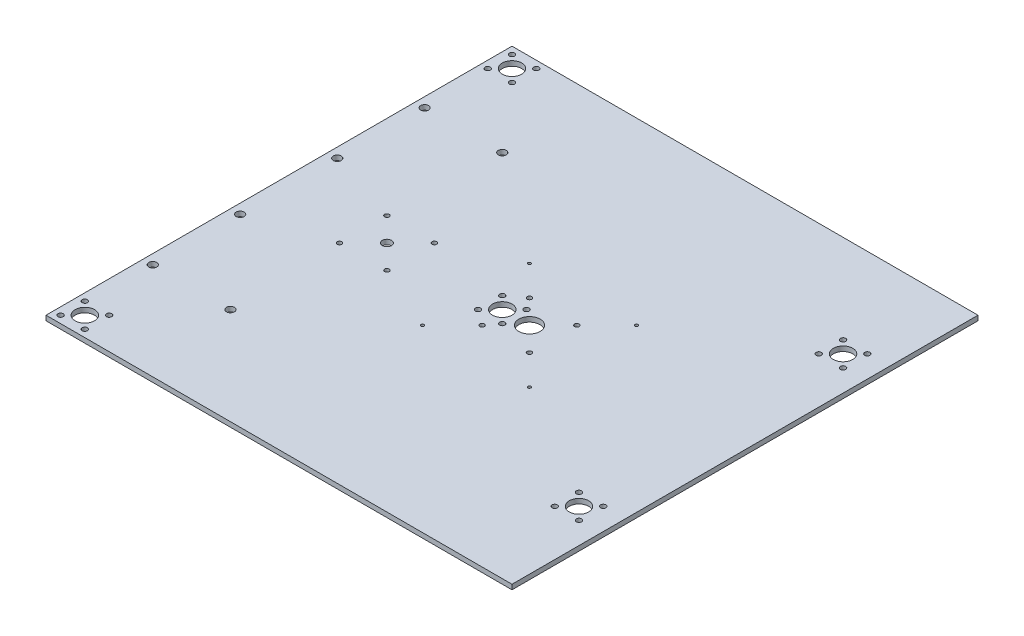
from build123d import *

# Parameters (mm, degrees)
SKETCH1_W               = 304.8
SKETCH1_H               = 304.8
BOSS_EXTRUDE1_DEPTH     = 3.175
SKETCH3_R               = 2.600000007
CUT_EXTRUDE1_DEPTH      = 216.549531721
SKETCH5_R               = 1.5
SKETCH5_R_2             = 2.999999969
CUT_EXTRUDE2_DEPTH      = 216.549531721
SKETCH7_R               = 0.999998
CUT_EXTRUDE3_DEPTH      = 216.549531721
CUT_EXTRUDE5_DEPTH      = 216.549531721
CUT_EXTRUDE5_DEPTH_BACK = 216.549531721
SKETCH9_R               = 1.726999975
SKETCH9_R_2             = 6.35
CUT_EXTRUDE6_DEPTH      = 216.549531721
CUT_EXTRUDE6_DEPTH_BACK = 216.549531721
SKETCH11_R              = 1.5
SKETCH11_R_2            = 6.985


with BuildPart() as part:
    # Sketch1 → Boss-Extrude1 (new body)
    with BuildSketch(Plane(origin=(0, 0, 0), x_dir=(1, 0, 0), z_dir=(0, 1, 0))):
        Rectangle(SKETCH1_W, SKETCH1_H)
    extrude(amount=BOSS_EXTRUDE1_DEPTH)

    # Sketch3 → Cut-Extrude1 (cut, through all)
    with BuildSketch(Plane(origin=(0, 3.175, 0), x_dir=(1, 0, 0), z_dir=(0, 1, 0))):
        with Locations((-146.05, -31.75)):
            Circle(SKETCH3_R)
        with Locations((-95.25, -88.9)):
            Circle(SKETCH3_R)
        with Locations((-146.05, -88.9)):
            Circle(SKETCH3_R)
    cut_extrude1 = extrude(amount=-CUT_EXTRUDE1_DEPTH, mode=Mode.SUBTRACT)

    # Mirror1: Cut-Extrude1 across plane
    add(cut_extrude1.mirror(Plane.XY), mode=Mode.SUBTRACT)

    # Sketch5 → Cut-Extrude2 (cut, through all)
    with BuildSketch(Plane(origin=(0, 3.175, 0), x_dir=(1, 0, 0), z_dir=(0, 1, 0))):
        with Locations((-66.312, 15.5)):
            Circle(SKETCH5_R)
        with Locations((-66.312, -15.5)):
            Circle(SKETCH5_R)
        with Locations((-97.312, 15.5)):
            Circle(SKETCH5_R)
        with Locations((-97.312, -15.5)):
            Circle(SKETCH5_R)
        with Locations((-81.812, 0)):
            Circle(SKETCH5_R_2)
    extrude(amount=-CUT_EXTRUDE2_DEPTH, mode=Mode.SUBTRACT)

    # Sketch7 → Cut-Extrude3 (cut, through all)
    with BuildSketch(Plane(origin=(0, 3.175, 0), x_dir=(1, 0, 0), z_dir=(0, 1, 0))):
        with Locations((46.431787507, -35.001787507)):
            Circle(SKETCH7_R)
        with Locations((-23.571787507, -35.001787507)):
            Circle(SKETCH7_R)
        with Locations((-23.571787507, 35.001787507)):
            Circle(SKETCH7_R)
        with Locations((46.431787507, 35.001787507)):
            Circle(SKETCH7_R)
    extrude(amount=-CUT_EXTRUDE3_DEPTH, mode=Mode.SUBTRACT)

    # Sketch9 → Cut-Extrude5 (cut, two sides: drawn at the far end of the back side and taken through both)
    with BuildSketch(Plane(origin=(0, 3.175, 0), x_dir=(1, 0, 0), z_dir=(0, 1, 0)).offset(-CUT_EXTRUDE5_DEPTH_BACK)):
        with Locations((-131.7625, -147.6375)):
            Circle(SKETCH9_R)
        with Locations((-131.7625, -131.7625)):
            Circle(SKETCH9_R)
        with Locations((-147.6375, -131.7625)):
            Circle(SKETCH9_R)
        with Locations((-147.6375, -147.6375)):
            Circle(SKETCH9_R)
        with Locations((-139.7, -139.7)):
            Circle(SKETCH9_R_2)
        with Locations((138.1125, -94.2975)):
            Circle(SKETCH9_R)
        with Locations((138.1125, -78.4225)):
            Circle(SKETCH9_R)
        with Locations((130.175, -86.36)):
            Circle(SKETCH9_R_2)
        with Locations((122.2375, -78.4225)):
            Circle(SKETCH9_R)
        with Locations((122.2375, -94.2975)):
            Circle(SKETCH9_R)
        with Locations((1.5875, 7.9375)):
            Circle(SKETCH9_R)
        with Locations((1.5875, -7.9375)):
            Circle(SKETCH9_R)
        with Locations((-6.35, 0)):
            Circle(SKETCH9_R_2)
        with Locations((-14.2875, -7.9375)):
            Circle(SKETCH9_R)
        with Locations((-14.2875, 7.9375)):
            Circle(SKETCH9_R)
        with Locations((122.2375, 94.2975)):
            Circle(SKETCH9_R)
        with Locations((122.2375, 78.4225)):
            Circle(SKETCH9_R)
        with Locations((138.1125, 94.2975)):
            Circle(SKETCH9_R)
        with Locations((130.175, 86.36)):
            Circle(SKETCH9_R_2)
        with Locations((138.1125, 78.4225)):
            Circle(SKETCH9_R)
        with Locations((-131.7625, 131.7625)):
            Circle(SKETCH9_R)
        with Locations((-131.7625, 147.6375)):
            Circle(SKETCH9_R)
        with Locations((-147.6375, 147.6375)):
            Circle(SKETCH9_R)
        with Locations((-147.6375, 131.7625)):
            Circle(SKETCH9_R)
        with Locations((-139.7, 139.7)):
            Circle(SKETCH9_R_2)
    extrude(amount=CUT_EXTRUDE5_DEPTH + CUT_EXTRUDE5_DEPTH_BACK, mode=Mode.SUBTRACT)

    # Sketch11 → Cut-Extrude6 (cut, two sides: drawn at the far end of the back side and taken through both)
    with BuildSketch(Plane(origin=(0, 3.175, 0), x_dir=(1, 0, 0), z_dir=(0, 1, 0)).offset(-CUT_EXTRUDE6_DEPTH_BACK)):
        with Locations((26.93, 15.5)):
            Circle(SKETCH11_R)
        with Locations((26.93, -15.5)):
            Circle(SKETCH11_R)
        with Locations((-4.07, -15.5)):
            Circle(SKETCH11_R)
        with Locations((-4.07, 15.5)):
            Circle(SKETCH11_R)
        with Locations((11.43, 0)):
            Circle(SKETCH11_R_2)
    extrude(amount=CUT_EXTRUDE6_DEPTH + CUT_EXTRUDE6_DEPTH_BACK, mode=Mode.SUBTRACT)


solid = part.part
